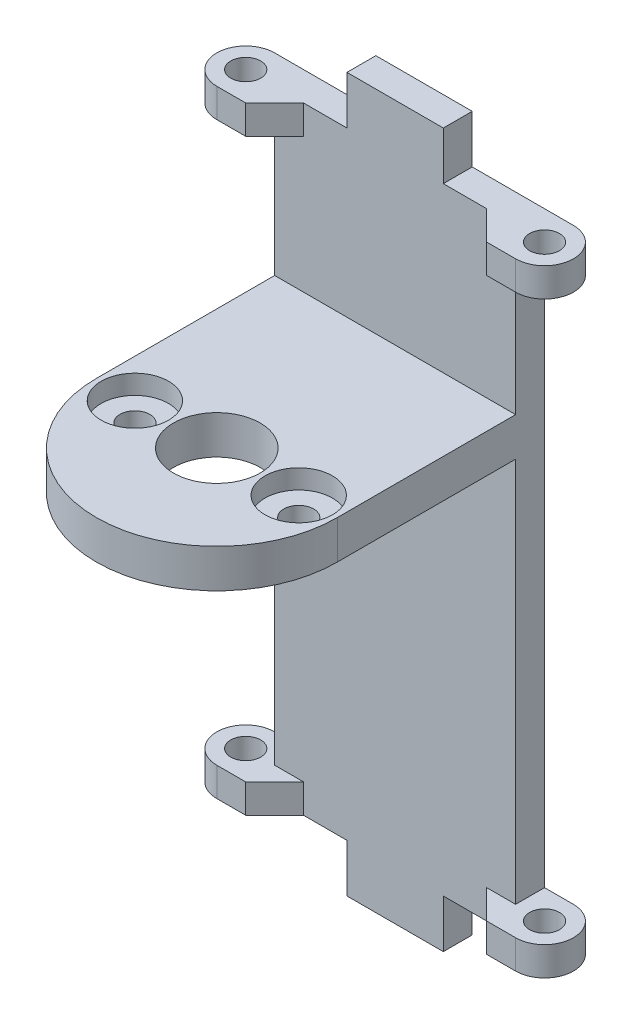
from build123d import *

# Parameters (mm, degrees)
SKETCH11_R          = 1.55
SKETCH11_R_2        = 4.5
BOSS_EXTRUDE1_DEPTH = 4
BOSS_EXTRUDE2_DEPTH = 3
SKETCH13_R          = 3.5
CUT_EXTRUDE1_DEPTH  = 2
SKETCH14_R          = 1.55
BOSS_EXTRUDE3_DEPTH = 3
BOSS_EXTRUDE4_START = -3
SKETCH15_R          = 1.55
BOSS_EXTRUDE4_DEPTH = 3


with BuildPart() as part:
    # Sketch11 → Boss-Extrude1 (new body)
    with BuildSketch(Plane(origin=(0, 0, 51.65), x_dir=(1, 0, 0), z_dir=(0, -1, 0))):
        with BuildLine():
            Line((12.5, 90), (12.5, 71.5))
            Line((12.5, 71.5), (-12.5, 71.5))
            Line((-12.5, 71.5), (-12.5, 90))
            ThreePointArc((-12.5, 90), (0, 102.5), (12.5, 90))
        make_face()
        with Locations((-8.5, 90)):
            Circle(SKETCH11_R, mode=Mode.SUBTRACT)
        with Locations((8.5, 90)):
            Circle(SKETCH11_R, mode=Mode.SUBTRACT)
        with Locations((0, 90)):
            Circle(SKETCH11_R_2, mode=Mode.SUBTRACT)
    extrude(amount=BOSS_EXTRUDE1_DEPTH)

    # Sketch12 → Boss-Extrude2 (add)
    with BuildSketch(Plane(origin=(0, 0, 123.15), x_dir=(-1, 0, 0), z_dir=(0, 0, -1))):
        Polygon((-12.5, 0), (-12.5, 17), (-5, 17), (-5, 22), (5, 22), (5, 17), (12.5, 17), (12.5, 0), (12.5, -4), (12.5, -47), (5, -47), (5, -52), (-5, -52), (-5, -47), (-12.5, -47), (-12.5, -4), align=None)
    extrude(amount=BOSS_EXTRUDE2_DEPTH)

    # Sketch13 → Cut-Extrude1 (cut)
    with BuildSketch(Plane(origin=(0, 0, 0), x_dir=(1, 0, 0), z_dir=(0, 1, 0))):
        with Locations((-8.5, -141.65)):
            Circle(SKETCH13_R)
        with Locations((8.5, -141.65)):
            Circle(SKETCH13_R)
    extrude(amount=-CUT_EXTRUDE1_DEPTH, mode=Mode.SUBTRACT)

    # Sketch14 → Boss-Extrude3 (add)
    with BuildSketch(Plane(origin=(0, 17, 0), x_dir=(1, 0, 0), z_dir=(0, 1, 0))):
        with BuildLine():
            Line((15.5, -120.15), (-15.5, -120.15))
            ThreePointArc((-15.5, -120.15), (-18.5, -123.15), (-15.5, -126.15))
            Line((-15.5, -126.15), (-12.5, -126.15))
            Line((-12.5, -126.15), (-9.5, -123.15))
            Line((-9.5, -123.15), (9.5, -123.15))
            Line((9.5, -123.15), (12.5, -126.15))
            Line((12.5, -126.15), (15.5, -126.15))
            ThreePointArc((15.5, -126.15), (18.5, -123.15), (15.5, -120.15))
        make_face()
        with Locations((-15.5, -123.15)):
            Circle(SKETCH14_R, mode=Mode.SUBTRACT)
        with Locations((15.5, -123.15)):
            Circle(SKETCH14_R, mode=Mode.SUBTRACT)
    extrude(amount=-BOSS_EXTRUDE3_DEPTH)

    # Sketch15 → Boss-Extrude4 (add)
    with BuildSketch(Plane(origin=(0, -47, 0), x_dir=(-1, 0, 0), z_dir=(0, -1, 0)).offset(BOSS_EXTRUDE4_START)):
        with BuildLine():
            Line((15.5, -120.15), (-15.5, -120.15))
            ThreePointArc((-15.5, -120.15), (-18.5, -123.15), (-15.5, -126.15))
            Line((-15.5, -126.15), (-12.5, -126.15))
            Line((-12.5, -126.15), (-9.5, -123.15))
            Line((-9.5, -123.15), (9.5, -123.15))
            Line((9.5, -123.15), (12.5, -126.15))
            Line((12.5, -126.15), (15.5, -126.15))
            ThreePointArc((15.5, -126.15), (18.5, -123.15), (15.5, -120.15))
        make_face()
        with Locations((15.5, -123.15)):
            Circle(SKETCH15_R, mode=Mode.SUBTRACT)
        with Locations((-15.5, -123.15)):
            Circle(SKETCH15_R, mode=Mode.SUBTRACT)
    extrude(amount=BOSS_EXTRUDE4_DEPTH)


solid = part.part
